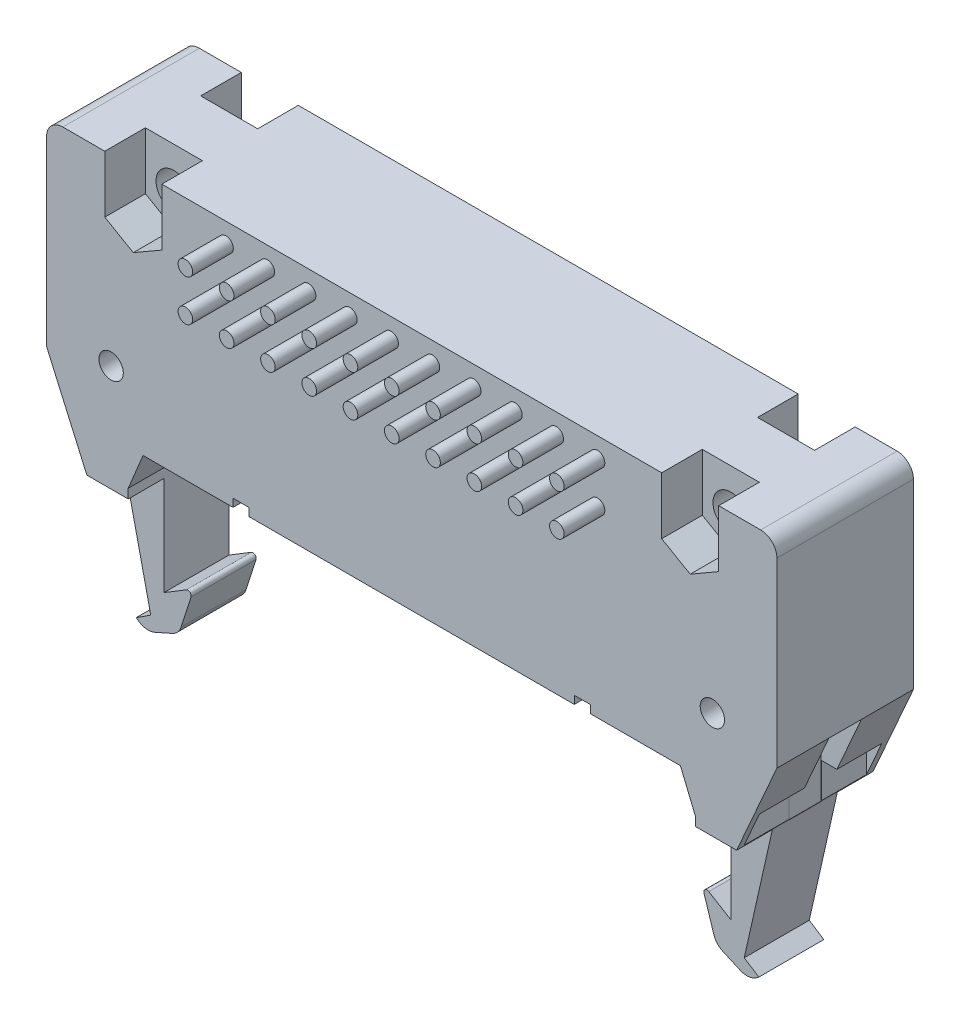
from build123d import *

# Parameters (mm, degrees)
EXTRUDE_1_DEPTH      = 8.4
SKETCH_2_W           = 3.875941336
SKETCH_2_H           = 10.635716013
CUT_EXTRUDE_1_DEPTH  = 150
SKETCH_3_W           = 2
SKETCH_3_H           = 5.614214587
CUT_EXTRUDE_2_DEPTH  = 2.5
SKETCH_4_W           = 7.533258122
SKETCH_4_H           = 2.2
CUT_EXTRUDE_3_DEPTH  = 2.45
SKETCH_5_W           = 2
SKETCH_5_H           = 5.614214587
CUT_EXTRUDE_4_DEPTH  = 2.5
SKETCH_6_W           = 2.766629061
SKETCH_6_H           = 2.133374911
CUT_EXTRUDE_5_DEPTH  = 2.45
SKETCH_7_W           = 33.064474368
SKETCH_7_H           = 5.5
CUT_EXTRUDE_6_DEPTH  = 10
SKETCH_8_R           = 0.45
EXTRUDE_2_DEPTH      = 8
SKETCH_9_R           = 1.1
SKETCH_9_R_2         = 0.75
SKETCH_9_W           = 1
SKETCH_9_H           = 0.97451262
CUT_EXTRUDE_7_DEPTH  = 10
SKETCH_10_W          = 29
SKETCH_10_H          = 2
CUT_EXTRUDE_8_DEPTH  = 2.5
CUT_EXTRUDE_9_DEPTH  = 2.5
SKETCH_12_W          = 4.6
SKETCH_12_H          = 9.297061896
CUT_EXTRUDE_10_DEPTH = 1.45
CHAMFER_1_SIZE       = 2
CUT_EXTRUDE_11_DEPTH = 0.2
SKETCH_14_R          = 0.45
EXTRUDE_3_DEPTH      = 2.5


with BuildPart() as part:
    # Эскиз1 → Вытянуть1 (new body)
    with BuildSketch(Plane.XY):
        with BuildLine():
            Line((-17.446127527, -11.858221261), (-16.532237184, -9.652950274))
            Line((-16.532237184, -9.652950274), (16.532237184, -9.652950274))
            Line((16.532237184, -9.652950274), (17.446127527, -11.858221261))
            Line((17.446127527, -11.858221261), (17.446127527, -18.516991449))
            Line((17.446127527, -18.516991449), (16.075858863, -17.684929687))
            ThreePointArc((16.075858863, -17.684929687), (15.848249479, -17.698805472), (15.781580168, -17.916873745))
            Line((15.781580168, -17.916873745), (16.395129243, -19.832909478))
            ThreePointArc((16.395129243, -19.832909478), (16.603928896, -20.196609982), (16.943503167, -20.442708876))
            Line((16.943503167, -20.442708876), (18.020929857, -20.918536331))
            ThreePointArc((18.020929857, -20.918536331), (18.534592927, -20.997740615), (19.018630756, -20.808451293))
            Line((19.018630756, -20.808451293), (19.156110829, -20.707015208))
            Line((19.156110829, -20.707015208), (18.260442561, -20.125628034))
            Line((18.260442561, -20.125628034), (19.990576145, -12.430286305))
            Line((19.990576145, -12.430286305), (22.47, -6.816071718))
            Line((22.47, -6.816071718), (22.47, 4.381463669))
            ThreePointArc((22.47, 4.381463669), (22.177106781, 5.08857045), (21.47, 5.381463669))
            Line((21.47, 5.381463669), (-21.47, 5.381463669))
            ThreePointArc((-21.47, 5.381463669), (-22.177106781, 5.08857045), (-22.47, 4.381463669))
            Line((-22.47, 4.381463669), (-22.47, -6.816071718))
            Line((-22.47, -6.816071718), (-19.990576145, -12.430286305))
            Line((-19.990576145, -12.430286305), (-18.260442561, -20.125628034))
            Line((-18.260442561, -20.125628034), (-19.156110829, -20.707015208))
            Line((-19.156110829, -20.707015208), (-19.018630756, -20.808451293))
            ThreePointArc((-19.018630756, -20.808451293), (-18.534592927, -20.997740615), (-18.020929857, -20.918536331))
            Line((-18.020929857, -20.918536331), (-16.943503167, -20.442708876))
            ThreePointArc((-16.943503167, -20.442708876), (-16.603928896, -20.196609982), (-16.395129243, -19.832909478))
            Line((-16.395129243, -19.832909478), (-15.781580168, -17.916873745))
            ThreePointArc((-15.781580168, -17.916873745), (-15.848249479, -17.698805472), (-16.075858863, -17.684929687))
            Line((-16.075858863, -17.684929687), (-17.446127527, -18.516991449))
            Line((-17.446127527, -18.516991449), (-17.446127527, -11.858221261))
        make_face()
    extrude(amount=EXTRUDE_1_DEPTH)

    # Эскиз2 → Вырез-Вытянуть1 (cut)
    with BuildSketch(Plane(origin=(22.47, 0, 0), x_dir=(0, 0, -1), z_dir=(1, 0, 0))):
        with Locations((-8.137970668, -17.748144312)):
            Rectangle(SKETCH_2_W, SKETCH_2_H)
        with Locations((-0.262029332, -17.748144312)):
            Rectangle(SKETCH_2_W, SKETCH_2_H)
    extrude(amount=-CUT_EXTRUDE_1_DEPTH, mode=Mode.SUBTRACT)

    # Эскиз3 → Вырез-Вытянуть2 (cut)
    with BuildSketch(Plane(origin=(22.47, 0, 0), x_dir=(0, 0, -1), z_dir=(1, 0, 0))):
        with Locations((-4.2, -9.623179012)):
            Rectangle(SKETCH_3_W, SKETCH_3_H)
    extrude(amount=-CUT_EXTRUDE_2_DEPTH, mode=Mode.SUBTRACT)

    # Эскиз4 → Вырез-Вытянуть3 (cut)
    with BuildSketch(Plane(origin=(22.47, 0, 0), x_dir=(0, 0, -1), z_dir=(1, 0, 0))):
        with Locations((-4.2, -11.330286305)):
            Rectangle(SKETCH_4_W, SKETCH_4_H)
    extrude(amount=-CUT_EXTRUDE_3_DEPTH, mode=Mode.SUBTRACT)

    # Эскиз5 → Вырез-Вытянуть4 (cut)
    with BuildSketch(Plane.ZY.offset(22.47)):
        with Locations((4.2, -9.623179012)):
            Rectangle(SKETCH_5_W, SKETCH_5_H)
    extrude(amount=-CUT_EXTRUDE_4_DEPTH, mode=Mode.SUBTRACT)

    # Эскиз6 → Вырез-Вытянуть5 (cut)
    with BuildSketch(Plane.ZY.offset(22.47)):
        with Locations((6.583314531, -11.296973761)):
            Rectangle(SKETCH_6_W, SKETCH_6_H)
        with Locations((1.81668547, -11.296973761)):
            Rectangle(SKETCH_6_W, SKETCH_6_H)
    extrude(amount=-CUT_EXTRUDE_5_DEPTH, mode=Mode.SUBTRACT)

    # Эскиз7 → Вырез-Вытянуть6 (cut)
    with BuildSketch(Plane.XZ.offset(9.652950274)):
        with Locations((0, 4.2)):
            Rectangle(SKETCH_7_W, SKETCH_7_H)
    extrude(amount=-CUT_EXTRUDE_6_DEPTH, mode=Mode.SUBTRACT)

    # Эскиз8 → Вытянуть2 (add)
    with BuildSketch(Plane.XZ.offset(-0.347049726)):
        with Locations(Location((6.35, 2.93, 0), (0, 0, 180))):
            Circle(SKETCH_8_R)
        with Locations(Location((6.35, 5.47, 0), (0, 0, 180))):
            Circle(SKETCH_8_R)
        with Locations(Location((1.27, 5.47, 0), (0, 0, 180))):
            Circle(SKETCH_8_R)
        with Locations(Location((1.27, 2.93, 0), (0, 0, 180))):
            Circle(SKETCH_8_R)
        with Locations(Location((3.81, 5.47, 0), (0, 0, 180))):
            Circle(SKETCH_8_R)
        with Locations(Location((3.81, 2.93, 0), (0, 0, 180))):
            Circle(SKETCH_8_R)
        with Locations(Location((-1.27, 5.47, 0), (0, 0, 180))):
            Circle(SKETCH_8_R)
        with Locations(Location((-1.27, 2.93, 0), (0, 0, 180))):
            Circle(SKETCH_8_R)
        with Locations(Location((-3.81, 5.47, 0), (0, 0, 180))):
            Circle(SKETCH_8_R)
        with Locations(Location((-3.81, 2.93, 0), (0, 0, 180))):
            Circle(SKETCH_8_R)
        with Locations(Location((8.89, 2.93, 0), (0, 0, 180))):
            Circle(SKETCH_8_R)
        with Locations(Location((8.89, 5.47, 0), (0, 0, 180))):
            Circle(SKETCH_8_R)
        with Locations(Location((11.43, 2.93, 0), (0, 0, 180))):
            Circle(SKETCH_8_R)
        with Locations(Location((11.43, 5.47, 0), (0, 0, 180))):
            Circle(SKETCH_8_R)
        with Locations(Location((-6.35, 5.47, 0), (0, 0, 180))):
            Circle(SKETCH_8_R)
        with Locations(Location((-6.35, 2.93, 0), (0, 0, 180))):
            Circle(SKETCH_8_R)
        with Locations(Location((-8.89, 5.47, 0), (0, 0, 180))):
            Circle(SKETCH_8_R)
        with Locations(Location((-8.89, 2.93, 0), (0, 0, 180))):
            Circle(SKETCH_8_R)
        with Locations(Location((-11.43, 5.47, 0), (0, 0, 180))):
            Circle(SKETCH_8_R)
        with Locations(Location((-11.43, 2.93, 0), (0, 0, 180))):
            Circle(SKETCH_8_R)
    extrude(amount=EXTRUDE_2_DEPTH)

    # Эскиз9 → Вырез-Вытянуть7 (cut)
    with BuildSketch(Plane(origin=(0, 0, 0), x_dir=(-1, 0, 0), z_dir=(0, 0, -1))):
        with Locations((-17.135, 2.881463669)):
            Circle(SKETCH_9_R)
        with Locations((17.135, 2.881463669)):
            Circle(SKETCH_9_R)
        with Locations((-18.5, -5.867574023)):
            Circle(SKETCH_9_R_2)
        with Locations((18.5, -5.867574023)):
            Circle(SKETCH_9_R_2)
        with Locations((10.5, -9.651420054)):
            Rectangle(SKETCH_9_W, SKETCH_9_H)
        with Locations((-10.5, -9.651420054)):
            Rectangle(SKETCH_9_W, SKETCH_9_H)
    extrude(amount=-CUT_EXTRUDE_7_DEPTH, mode=Mode.SUBTRACT)

    # Эскиз10 → Вырез-Вытянуть8 (cut)
    with BuildSketch(Plane(origin=(0, 0, 0), x_dir=(-1, 0, 0), z_dir=(0, 0, -1))):
        Polygon((-18.889432173, 3.987610768), (-18.889432173, 6.55660708), (-15.380567827, 6.55660708), (-15.380567827, 3.987610768), (-15.380567827, 1.868541782), (-17.135, 0.855619895), (-18.889432173, 1.868541782), align=None)
        Polygon((15.380567827, 6.55660708), (15.380567827, 3.987610768), (15.380567827, 1.868541782), (17.135, 0.855619895), (18.889432173, 1.868541782), (18.889432173, 3.987610768), (18.889432173, 6.55660708), align=None)
        with Locations((0, 2.868541782)):
            Rectangle(SKETCH_10_W, SKETCH_10_H)
    extrude(amount=-CUT_EXTRUDE_8_DEPTH, mode=Mode.SUBTRACT)

    # Эскиз11 → Вырез-Вытянуть9 (cut)
    with BuildSketch(Plane.XY.offset(8.4)):
        Polygon((18.889432173, 1.868541782), (18.889432173, 5.381463669), (15.380567827, 5.381463669), (15.380567827, 1.868541782), (17.135, 0.855619895), align=None)
        Polygon((-15.380567827, 5.381463669), (-18.889432173, 5.381463669), (-18.889432173, 1.868541782), (-17.135, 0.855619895), (-15.380567827, 1.868541782), align=None)
    extrude(amount=-CUT_EXTRUDE_9_DEPTH, mode=Mode.SUBTRACT)

    # Эскиз12 → Вырез-Вытянуть10 (cut)
    with BuildSketch(Plane(origin=(0, 0, 0), x_dir=(-1, 0, 0), z_dir=(0, 0, -1))):
        with Locations((0, -6.301481222)):
            Rectangle(SKETCH_12_W, SKETCH_12_H)
    extrude(amount=-CUT_EXTRUDE_10_DEPTH, mode=Mode.SUBTRACT)

    # Фаска1
    # the kernel refuses this chamfer: 2 mm, written as the material it takes off along each edge
    with BuildSketch(Plane(origin=(-2.3, -1.652950274, 0), x_dir=(0, 0.9996219169112968, -0.027495876610586365), z_dir=(1, 0, 0))) as chamfer_1_piece_1:
        Polygon((CHAMFER_1_SIZE * 0.999621916911, CHAMFER_1_SIZE * 0.0274958766106), (-CHAMFER_1_SIZE * 0.0274958766106, CHAMFER_1_SIZE * 0.999621916911), (0, 0), align=None)
    extrude(amount=4.6, mode=Mode.SUBTRACT)

    # Эскиз13 → Вырез-Вытянуть11 (cut)
    with BuildSketch(Plane(origin=(0, 0, 0), x_dir=(-1, 0, 0), z_dir=(0, 0, -1))):
        Polygon((13.517225103, -9.652950274), (14.480668436, -9.652950274), (13.99894677, -8.818583872), align=None)
    extrude(amount=-CUT_EXTRUDE_11_DEPTH, mode=Mode.SUBTRACT)

    # Эскиз14 → Вытянуть3 (add)
    with BuildSketch(Plane.XY.offset(8.4)):
        with Locations(Location((6.35, 4.151463669, 0), (0, 0, 180))):
            Circle(SKETCH_14_R)
        with Locations(Location((6.35, 1.611463669, 0), (0, 0, 180))):
            Circle(SKETCH_14_R)
        with Locations(Location((1.27, 4.151463669, 0), (0, 0, 180))):
            Circle(SKETCH_14_R)
        with Locations(Location((1.27, 1.611463669, 0), (0, 0, 180))):
            Circle(SKETCH_14_R)
        with Locations(Location((3.81, 4.151463669, 0), (0, 0, 180))):
            Circle(SKETCH_14_R)
        with Locations(Location((3.81, 1.611463669, 0), (0, 0, 180))):
            Circle(SKETCH_14_R)
        with Locations(Location((-1.27, 4.151463669, 0), (0, 0, 180))):
            Circle(SKETCH_14_R)
        with Locations(Location((-1.27, 1.611463669, 0), (0, 0, 180))):
            Circle(SKETCH_14_R)
        with Locations(Location((-3.81, 4.151463669, 0), (0, 0, 180))):
            Circle(SKETCH_14_R)
        with Locations(Location((-3.81, 1.611463669, 0), (0, 0, 180))):
            Circle(SKETCH_14_R)
        with Locations(Location((8.89, 4.151463669, 0), (0, 0, 180))):
            Circle(SKETCH_14_R)
        with Locations(Location((8.89, 1.611463669, 0), (0, 0, 180))):
            Circle(SKETCH_14_R)
        with Locations(Location((11.43, 4.151463669, 0), (0, 0, 180))):
            Circle(SKETCH_14_R)
        with Locations(Location((11.43, 1.611463669, 0), (0, 0, 180))):
            Circle(SKETCH_14_R)
        with Locations(Location((-6.35, 1.611463669, 0), (0, 0, 180))):
            Circle(SKETCH_14_R)
        with Locations(Location((-6.35, 4.151463669, 0), (0, 0, 180))):
            Circle(SKETCH_14_R)
        with Locations(Location((-8.89, 1.611463669, 0), (0, 0, 180))):
            Circle(SKETCH_14_R)
        with Locations(Location((-8.89, 4.151463669, 0), (0, 0, 180))):
            Circle(SKETCH_14_R)
        with Locations(Location((-11.43, 1.611463669, 0), (0, 0, 180))):
            Circle(SKETCH_14_R)
        with Locations(Location((-11.43, 4.151463669, 0), (0, 0, 180))):
            Circle(SKETCH_14_R)
    extrude(amount=EXTRUDE_3_DEPTH)


solid = part.part
